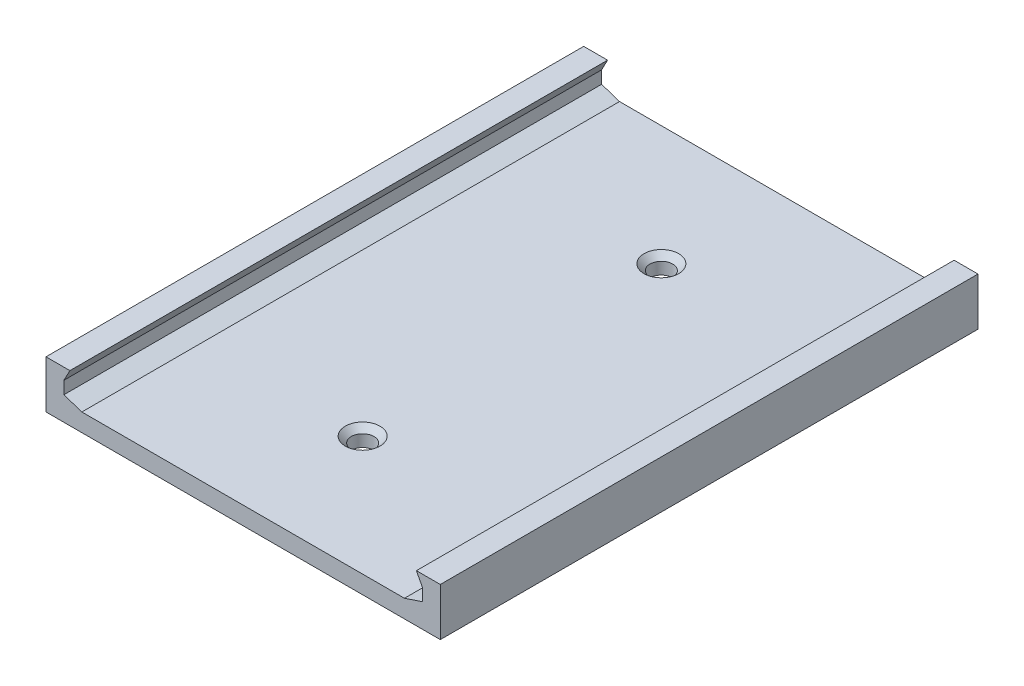
from build123d import *

# Parameters (mm, degrees)
SKETCH_1_W     = 66
SKETCH_1_H     = 3
BASE_DEPTH     = 90
RAILS_DEPTH    = 90
SKETCH_3_R     = 1.9
HOLES_DEPTH    = 112.718395978
CHAMFER_1_SIZE = 1


with BuildPart() as part:
    # Эскиз1 → base (new body)
    with BuildSketch(Plane.XY):
        with Locations((33, 1.5)):
            Rectangle(SKETCH_1_W, SKETCH_1_H)
    extrude(amount=BASE_DEPTH)

    # Эскиз2 → rails (add)
    with BuildSketch(Plane.XY):
        Polygon((0, 3), (6, 3), (3, 4), (3, 6.1), (4, 8), (0, 8), align=None)
        Polygon((63, 6.1), (62, 8), (66, 8), (66, 3), (60, 3), (63, 4), align=None)
    extrude(amount=RAILS_DEPTH)

    # Эскиз3 → holes (cut, through all)
    with BuildSketch(Plane(origin=(0, 3, 0), x_dir=(1, 0, 0), z_dir=(0, 1, 0))):
        with Locations((33, -20)):
            Circle(SKETCH_3_R)
        with Locations((33, -70)):
            Circle(SKETCH_3_R)
    extrude(amount=-HOLES_DEPTH, mode=Mode.SUBTRACT)

    # Фаска1
    chamfer_1_edges = [part.edges().sort_by_distance(p)[0] for p in [
        (31.1, 3, 20),
        (31.1, 3, 70),
    ]]
    chamfer(chamfer_1_edges, length=CHAMFER_1_SIZE)


solid = part.part
